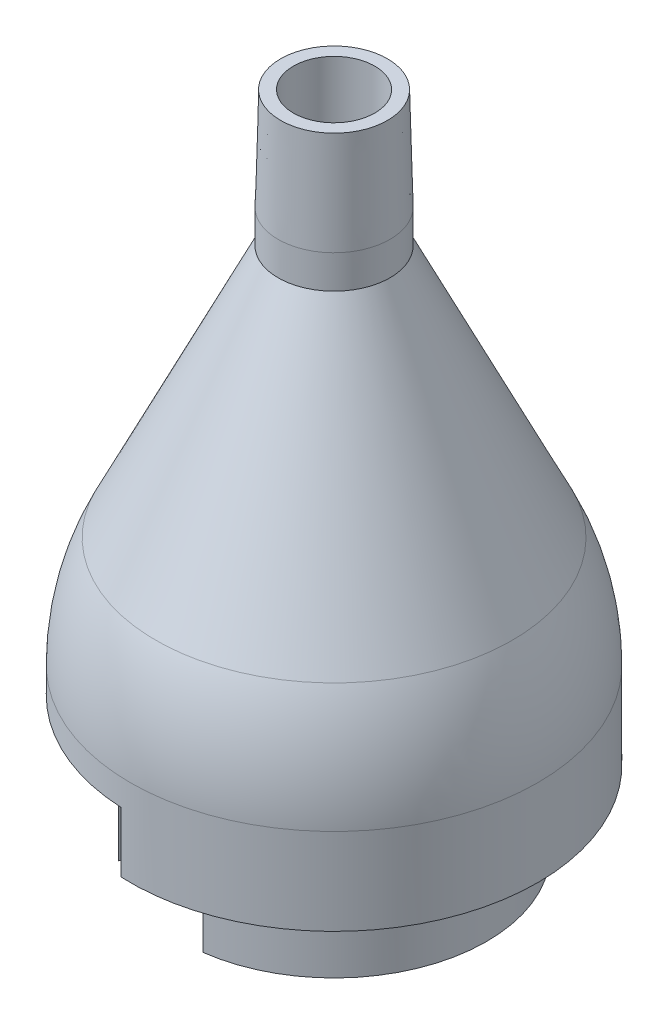
from build123d import *

# Parameters (mm, degrees)
ESBO_O1_R                     = 40
ESBO_O1_R_2                   = 30
RESSALTO_EXTRUS_O1_DEPTH      = 50
ESBO_O2_R                     = 1.500000000000004
ESBO_O2_R_2                   = 1.4999999999999962
ESBO_O2_R_3                   = 1.5
ESBO_O2_R_4                   = 1.500000000000002
ESBO_O2_R_5                   = 1.5000000000000018
CORTE_EXTRUS_O1_DEPTH         = 10
CORTE_EXTRUS_O2_DEPTH         = 11.84997677
RESSALTO_EXTRUS_O2_DEPTH      = 26.849976769999998
RESSALTO_EXTRUS_O2_DEPTH_BACK = 10
REVOLU_O1_ANGLE               = 180.0000000000004
RESSALTO_EXTRUS_O5_DEPTH      = 5
RESSALTO_EXTRUS_O5_DEPTH_BACK = 2
ESBO_O10_R                    = 11
ESBO_O13_R                    = 8
CORTE_EXTRUS_O4_DEPTH         = 40
CORTE_EXTRUS_O5_DEPTH         = 120
FILETE1_R                     = 50
FILETE2_R                     = 50


# Read off the part's stored shape, not the designer's step: Limites1, Limites2, Limites-Corte1
with BuildPart() as part:
    # Esboço1 → Ressalto-extrusão1 (new body)
    with BuildSketch(Plane(origin=(0, 0, 0), x_dir=(1, 0, 0), z_dir=(0, 1, 0))):
        with Locations(Location((0, 0, 0), (0, 0, 270))):
            Circle(ESBO_O1_R)
        with Locations(Location((0, 0, 0), (0, 0, 270))):
            Circle(ESBO_O1_R_2, mode=Mode.SUBTRACT)
    extrude(amount=RESSALTO_EXTRUS_O1_DEPTH)

    # Esboço2 → Corte-extrusão1 (cut)
    with BuildSketch(Plane(origin=(0, 0, 0), x_dir=(-1, 0, 0), z_dir=(0, -1, 0))):
        with Locations(Location((-21.160269082529076, -29.124611797498083, 0), (0, 0, 90))):
            Circle(ESBO_O2_R)
        with Locations(Location((-34.23803458662555, -11.124611797498012, 0), (0, 0, 90))):
            Circle(ESBO_O2_R_2)
        with Locations(Location((-34.23803458662548, 11.124611797498257, 0), (0, 0, 90))):
            Circle(ESBO_O2_R_3)
        with Locations(Location((21.16026908252929, 29.124611797497916, 0), (0, 0, 90))):
            Circle(ESBO_O2_R_4)
        with Locations(Location((34.23803458662564, 11.124611797497778, 0), (0, 0, 90))):
            Circle(ESBO_O2_R_5)
        with Locations(Location((34.2380345866254, -11.124611797498495, 0), (0, 0, 90))):
            Circle(ESBO_O2_R_4)
    extrude(amount=-CORTE_EXTRUS_O1_DEPTH, mode=Mode.SUBTRACT)

    # Esboço3 → Corte-extrusão2 (cut)
    with BuildSketch(Plane(origin=(0, 0, 0), x_dir=(-1, 0, 0), z_dir=(0, -1, 0))):
        with BuildLine():
            ThreePointArc((30.293924667807104, -13.087327008263706), (31.253408488730912, 10.59360457240701), (16.0923575286481, 28.810345870366824))
            Line((16.092357528648105, 28.810345870366824), (19.505887913512822, 34.921631358020406))
            ThreePointArc((19.505887913512836, 34.9216313580204), (8.030354378354186, 39.18562757642205), (-4.197370072970371, 39.77916646274194))
            Line((-4.19737007297038, 39.779166462741934), (-3.1480275547272187, 29.83437484705651))
            ThreePointArc((-3.148027554727219, 29.834374847056512), (29.911212101346653, 2.3063804170720696), (1.462902849126346, -29.964310692122016))
            Line((1.4629028491263463, -29.96431069212202), (1.9505371321681024, -39.952414256162704))
            ThreePointArc((1.9505371321681024, -39.952414256162704), (22.185986251539575, -33.283359416478625), (36.12685933386897, -17.171197822832383))
            Line((36.12685933386898, -17.171197822832383), (30.293924667807104, -13.087327008263708))
        make_face()
    extrude(amount=-CORTE_EXTRUS_O2_DEPTH, mode=Mode.SUBTRACT)

    # Esboço4 → Ressalto-extrusão2 (add, two sides: drawn at the far end of the back side and taken through both)
    with BuildSketch(Plane(origin=(0, 11.84997677, 0), x_dir=(-1, 0, 0), z_dir=(0, -1, 0)).offset(-RESSALTO_EXTRUS_O2_DEPTH_BACK)):
        with BuildLine():
            Line((-4.008838628941714, -29.730947056007228), (-4.700362462642585, -27.60265553746198))
            ThreePointArc((-4.700362462642585, -27.60265553746198), (-8.119302431706847, 26.796957439651234), (19.23025849893697, -20.351834267801586))
            Line((19.23025849893697, -20.351834267801586), (19.909240802048483, -22.441526924121003))
            ThreePointArc((19.909240802048483, -22.441526924121003), (-8.745833795666464, 28.696870756557733), (-4.008838628941714, -29.730947056007228))
        make_face()
    extrude(amount=RESSALTO_EXTRUS_O2_DEPTH + RESSALTO_EXTRUS_O2_DEPTH_BACK)

    # Esboço9 → Revolução1 (revolve)
    with BuildSketch(Plane(origin=(0, 50, 0), x_dir=(1, 0, 0), z_dir=(0, 1, 0))):
        with BuildLine():
            Line((-40, 0), (-30, 0))
            ThreePointArc((-30, 0), (1.84e-15, 30), (30, 0))
            Line((30, 0), (40, 0))
            ThreePointArc((40, 0), (2.45e-15, 40), (-40, 0))
        make_face()
    revolve(axis=Axis((-40, 50, 0), (1, 0, 0)), revolution_arc=REVOLU_O1_ANGLE)

    # Esboço10 → Ressalto-extrusão5 (add, two sides: drawn at the far end of the back side and taken through both)
    with BuildSketch(Plane(origin=(0, 90, 0), x_dir=(1, 0, 0), z_dir=(0, 1, 0)).offset(-RESSALTO_EXTRUS_O5_DEPTH_BACK)):
        with Locations(Location((0, 0, 0), (0, 0, 270))):
            Circle(ESBO_O10_R)
    extrude(amount=RESSALTO_EXTRUS_O5_DEPTH + RESSALTO_EXTRUS_O5_DEPTH_BACK)

    # Limites1 outline → Limites1 (revolve)
    with BuildSketch(Plane.XY):
        Polygon((11, 95), (10.5, 115), (0, 115), (0, 95), align=None)
    revolve(axis=Axis((0, 0, 0), (0, 1, 0)))

    # Esboço13 → Corte-extrusão4 (cut)
    with BuildSketch(Plane(origin=(0, 115, 0), x_dir=(1, 0, 0), z_dir=(0, 1, 0))):
        with Locations(Location((0, 0, 0), (0, 0, 270))):
            Circle(ESBO_O13_R)
    extrude(amount=-CORTE_EXTRUS_O4_DEPTH, mode=Mode.SUBTRACT)

    # Esboço14 → Corte-extrusão5 (cut)
    with BuildSketch(Plane(origin=(61.11285487653572, 0, -34.135303848647126), x_dir=(-0.487647197837817, 0, -0.8730407839505122), z_dir=(0.8730407839505123, 0, -0.48764719783781707))):
        Polygon((54.65634856725553, 88.45776904605881), (-53.65162953624658, 88.45776904605881), (-53.651629536246595, 28.457769046058818), (54.65634856725555, 28.457769046058818), align=None)
    extrude(amount=-CORTE_EXTRUS_O5_DEPTH, mode=Mode.SUBTRACT)


with BuildPart() as corte_extrus_o5_piece_1:
    # of the separate pieces the step leaves, piece 1, a body of its own (corte_extrus_o5_pieces)
    add(part.part.solids().sort_by_distance((0, 0, 40))[0])



with BuildPart() as corte_extrus_o5_piece_2:
    # of the separate pieces the step leaves, piece 2, a body of its own (corte_extrus_o5_pieces)
    add(part.part.solids().sort_by_distance((0, 88.457769046, 11))[0])


with BuildPart() as corte_extrus_o5_piece_1_1:
    add(corte_extrus_o5_piece_1.part)

    add(corte_extrus_o5_piece_2.part)  # Limites2 merges Corte-extrusão5 piece 2
    # Limites2 outline → Limites2 (revolve)
    with BuildSketch(Plane.XY):
        Polygon((0, 88.457769046), (0, 28.457769046), (40, 28.457769046), (11, 88.457769046), align=None)
    revolve(axis=Axis((0, 0, 0), (0, 1, 0)))

    # Limites-Corte1 outline → Limites-Corte1 (revolve, cut)
    with BuildSketch(Plane.XY):
        Polygon((30, 28.457769046), (8, 88.457769046), (0, 88.457769046), (0, 28.457769046), align=None)
    revolve(axis=Axis((0, 0, 0), (0, 1, 0)), mode=Mode.SUBTRACT)

    # Filete1
    # the kernel refuses this fillet: 50 mm, written as the material it takes off along each edge
    with BuildSketch(Plane(origin=(0, 28.457769046058818, 0), x_dir=(-1.8e-16, 0, 1), z_dir=(1, 0, 1.8e-16))) as filete1_piece_1:
        with BuildLine():
            CenterArc((40 - FILETE1_R, FILETE1_R * 0.228994080214), FILETE1_R, 334.2039735055, 25.79602649449996)
            Line((40, FILETE1_R * 0.228994080214), (40, 0))
            Line((40, 0), (40 - FILETE1_R * 0.0996510471581, -FILETE1_R * 0.206174580326))
        make_face()
    revolve(axis=Axis((0, 28.457769046058818, 0), (0, -1, 0)), revolution_arc=270, mode=Mode.SUBTRACT)
    with BuildSketch(Plane(origin=(0, 28.457769046058818, 0), x_dir=(1, 0, 0), z_dir=(0, 0, -1))) as filete1_piece_2:
        with BuildLine():
            CenterArc((40 - FILETE1_R, FILETE1_R * 0.228994080214), FILETE1_R, 334.2039735055, 25.79602649449996)
            Line((40, FILETE1_R * 0.228994080214), (40, 0))
            Line((40, 0), (40 - FILETE1_R * 0.0996510471581, -FILETE1_R * 0.206174580326))
        make_face()
    revolve(axis=Axis((0, 28.457769046058818, 0), (0, -1, 0)), revolution_arc=90, mode=Mode.SUBTRACT)

    # Filete2
    # the kernel refuses this fillet: 50 mm, written as the material it adds along each edge
    with BuildSketch(Plane(origin=(0, 28.457769046058818, 0), x_dir=(-1.8e-16, 0, 1), z_dir=(1, 0, 1.8e-16))) as filete2_piece_1:
        with BuildLine():
            CenterArc((30 - FILETE2_R, FILETE2_R * 0.177553692487), FILETE2_R, 339.86369657175186, 20.136303428248137)
            Line((30.000000000000007, FILETE2_R * 0.177553692487), (30, 0))
            Line((30, 0), (30 - FILETE2_R * 0.0611236841134, -FILETE2_R * 0.166700956672))
        make_face()
    revolve(axis=Axis((0, 28.457769046058818, 0), (0, -1, 0)), revolution_arc=270)
    with BuildSketch(Plane(origin=(0, 28.457769046058818, 0), x_dir=(1, 0, 0), z_dir=(0, 0, -1))) as filete2_piece_2:
        with BuildLine():
            CenterArc((30 - FILETE2_R, FILETE2_R * 0.177553692487), FILETE2_R, 339.86369657175186, 20.136303428248137)
            Line((30.000000000000007, FILETE2_R * 0.177553692487), (30, 0))
            Line((30, 0), (30 - FILETE2_R * 0.0611236841134, -FILETE2_R * 0.166700956672))
        make_face()
    revolve(axis=Axis((0, 28.457769046058818, 0), (0, -1, 0)), revolution_arc=90)


solid = corte_extrus_o5_piece_1_1.part
